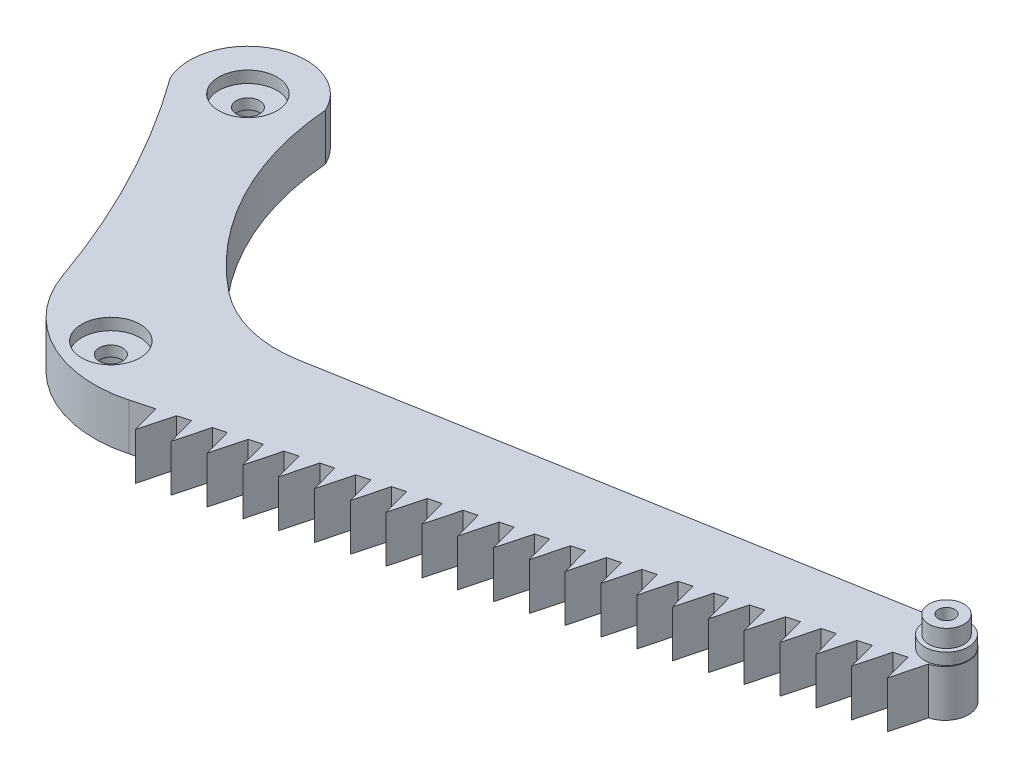
from build123d import *

# Parameters (mm, degrees)
SKETCH1_R                = 1.4
BOSS_EXTRUDE1_DEPTH      = 8
SKETCH2_R                = 3.75
BOSS_EXTRUDE2_DEPTH      = 2
SKETCH3_R                = 3
BOSS_EXTRUDE3_DEPTH      = 3
CUT_EXTRUDE1_DEPTH       = 153.777621068
CUT_EXTRUDE1_DEPTH_BACK  = 153.777621068
SKETCH4_R                = 1.4
FILLET1_R                = 4
SKETCH5_R                = 5.1
CUT_EXTRUDE2_DEPTH       = 3.2
SKETCH6_R                = 4
CUT_EXTRUDE3_DEPTH       = 1
SKETCH7_R                = 5
CUT_EXTRUDE4_DEPTH       = 2
CUT_EXTRUDE5_DEPTH       = 128.709870942
CUT_EXTRUDE5_DEPTH_BACK  = 128.709870942
SKETCH8_R                = 2
SKETCH9_W                = 150
SKETCH9_H                = 50
CUT_EXTRUDE6_DEPTH       = 128.657240829
BOSS_EXTRUDE4_DEPTH      = 8
FILLET2_R                = 10
SKETCH11_R               = 5.25
CUT_EXTRUDE7_DEPTH       = 3.2
SKETCH12_R               = 4
CUT_EXTRUDE8_DEPTH       = 1
SKETCH13_R               = 5
CUT_EXTRUDE9_DEPTH       = 2
CUT_EXTRUDE10_DEPTH      = 128.709870942
CUT_EXTRUDE10_DEPTH_BACK = 128.709870942
SKETCH14_R               = 2
CUT_EXTRUDE11_DEPTH      = 128.657240829
CUT_EXTRUDE11_DEPTH_BACK = 128.657240829
FILLET3_R                = 20
CUT_EXTRUDE12_DEPTH      = 128.657240829
CUT_EXTRUDE12_DEPTH_BACK = 128.657240829
FILLET4_R                = 20
FILLET5_R                = 20
BOSS_EXTRUDE5_DEPTH      = 8
LPATTERN1_COUNT          = 22
LPATTERN1_PITCH          = 5
SKETCH19_R               = 5.25
CUT_EXTRUDE13_DEPTH      = 3.2
SKETCH20_R               = 4
CUT_EXTRUDE14_DEPTH      = 1
CUT_EXTRUDE15_DEPTH      = 129.03726605
CUT_EXTRUDE15_DEPTH_BACK = 129.03726605
SKETCH21_R               = 2
SKETCH22_R               = 5
CUT_EXTRUDE16_DEPTH      = 2


# Some blends are built 0.0001 mm under size
with BuildPart() as part:
    # Sketch1 → Boss-Extrude1 (new body)
    with BuildSketch(Plane(origin=(0, 0, 0), x_dir=(1, 0, 0), z_dir=(0, 1, 0))):
        Polygon((-146.874100845, 0), (146.874100845, 0), (0, -40), align=None)
        with Locations(Location((-117.130755004, -3.915785767, 0), (0, 0, 270))):
            Circle(SKETCH1_R, mode=Mode.SUBTRACT)
        with Locations(Location((0, -30, 0), (0, 0, 270))):
            Circle(SKETCH1_R, mode=Mode.SUBTRACT)
        with Locations(Location((117.130755004, -3.915785767, 0), (0, 0, 270))):
            Circle(SKETCH1_R, mode=Mode.SUBTRACT)
    extrude(amount=BOSS_EXTRUDE1_DEPTH)

    # Sketch2 → Boss-Extrude2 (add)
    with BuildSketch(Plane(origin=(0, 8, 0), x_dir=(1, 0, 0), z_dir=(0, 1, 0))):
        with Locations(Location((117.130755004, -3.915785767, 0), (0, 0, 90))):
            Circle(SKETCH2_R)
    extrude(amount=BOSS_EXTRUDE2_DEPTH)

    # Sketch3 → Boss-Extrude3 (add)
    with BuildSketch(Plane(origin=(0, 10, 0), x_dir=(1, 0, 0), z_dir=(0, 1, 0))):
        with Locations(Location((117.130755004, -3.915785767, 0), (0, 0, 270))):
            Circle(SKETCH3_R)
    extrude(amount=BOSS_EXTRUDE3_DEPTH)

    # Sketch4 → Cut-Extrude1 (cut, two sides: drawn at the far end of the back side and taken through both)
    with BuildSketch(Plane(origin=(0, 13, 0), x_dir=(1, 0, 0), z_dir=(0, 1, 0)).offset(-CUT_EXTRUDE1_DEPTH_BACK)):
        with Locations(Location((117.130755004, -3.915785767, 0), (0, 0, 270))):
            Circle(SKETCH4_R)
    extrude(amount=CUT_EXTRUDE1_DEPTH + CUT_EXTRUDE1_DEPTH_BACK, mode=Mode.SUBTRACT)

    # Fillet1
    fillet1_edges = [part.edges().sort_by_distance(p)[0] for p in [
        (-146.874100845, 4, 0),
        (146.874100845, 4, 0),
    ]]
    fillet(fillet1_edges, radius=FILLET1_R)

    # Sketch5 → Cut-Extrude2 (cut)
    with BuildSketch(Plane.XZ):
        with Locations((-117.130755004, 3.915785767)):
            Circle(SKETCH5_R)
    extrude(amount=-CUT_EXTRUDE2_DEPTH, mode=Mode.SUBTRACT)

    # Sketch6 → Cut-Extrude3 (cut)
    with BuildSketch(Plane.XZ.offset(-3.2)):
        with Locations((-117.130755004, 3.915785767)):
            Circle(SKETCH6_R)
    extrude(amount=-CUT_EXTRUDE3_DEPTH, mode=Mode.SUBTRACT)

    # Sketch7 → Cut-Extrude4 (cut)
    with BuildSketch(Plane(origin=(0, 8, 0), x_dir=(1, 0, 0), z_dir=(0, 1, 0))):
        with Locations((-117.130755004, -3.915785767)):
            Circle(SKETCH7_R)
    extrude(amount=-CUT_EXTRUDE4_DEPTH, mode=Mode.SUBTRACT)

    # Sketch8 → Cut-Extrude5 (cut, two sides: drawn at the far end of the back side and taken through both)
    with BuildSketch(Plane.XZ.offset(-4.2).offset(-CUT_EXTRUDE5_DEPTH_BACK)):
        with Locations(Location((-117.130755004, 3.915785767, 0), (0, 0, 270))):
            Circle(SKETCH8_R)
    extrude(amount=CUT_EXTRUDE5_DEPTH + CUT_EXTRUDE5_DEPTH_BACK, mode=Mode.SUBTRACT)

    # Sketch9 → Cut-Extrude6 (cut, through all)
    with BuildSketch(Plane(origin=(0, 8, 0), x_dir=(1, 0, 0), z_dir=(0, 1, 0))):
        with Locations((-85, -25)):
            Rectangle(SKETCH9_W, SKETCH9_H)
    extrude(amount=-CUT_EXTRUDE6_DEPTH, mode=Mode.SUBTRACT)

    # Sketch10 → Boss-Extrude4 (add)
    with BuildSketch(Plane(origin=(0, 8, 0), x_dir=(1, 0, 0), z_dir=(0, 1, 0))):
        Polygon((-10, -37.276579072), (-38.232590814, 23.268407311), (-20.106435073, 31.720772546), (-5.314795912, 0), (-10, 0), align=None)
    extrude(amount=-BOSS_EXTRUDE4_DEPTH)

    # Fillet2
    fillet2_edges = [part.edges().sort_by_distance(p)[0] for p in [
        (-20.106435073, 4, -31.720772546),
        (-38.232590814, 4, -23.268407311),
    ]]
    fillet(fillet2_edges, radius=FILLET2_R - 0.0001)  # a hair under: the kernel refuses the full size

    # Sketch11 → Cut-Extrude7 (cut)
    with BuildSketch(Plane.XZ):
        with Locations(Location((-24.943330326, -18.431512059, 0), (0, 0, 270))):
            Circle(SKETCH11_R)
    extrude(amount=-CUT_EXTRUDE7_DEPTH, mode=Mode.SUBTRACT)

    # Sketch12 → Cut-Extrude8 (cut)
    with BuildSketch(Plane.XZ.offset(-3.2)):
        with Locations(Location((-24.943330326, -18.431512059, 0), (0, 0, 270))):
            Circle(SKETCH12_R)
    extrude(amount=-CUT_EXTRUDE8_DEPTH, mode=Mode.SUBTRACT)

    # Sketch13 → Cut-Extrude9 (cut)
    with BuildSketch(Plane(origin=(0, 8, 0), x_dir=(1, 0, 0), z_dir=(0, 1, 0))):
        with Locations(Location((-24.943330326, 18.431512059, 0), (0, 0, 270))):
            Circle(SKETCH13_R)
    extrude(amount=-CUT_EXTRUDE9_DEPTH, mode=Mode.SUBTRACT)

    # Sketch14 → Cut-Extrude10 (cut, two sides: drawn at the far end of the back side and taken through both)
    with BuildSketch(Plane.XZ.offset(-4.2).offset(-CUT_EXTRUDE10_DEPTH_BACK)):
        with Locations(Location((-24.943330326, -18.431512059, 0), (0, 0, 270))):
            Circle(SKETCH14_R)
    extrude(amount=CUT_EXTRUDE10_DEPTH + CUT_EXTRUDE10_DEPTH_BACK, mode=Mode.SUBTRACT)

    # Sketch16 → Cut-Extrude11 (cut, two sides: drawn at the far end of the back side and taken through both)
    with BuildSketch(Plane(origin=(0, 8, 0), x_dir=(1, 0, 0), z_dir=(0, 1, 0)).offset(-CUT_EXTRUDE11_DEPTH_BACK)):
        Polygon((-5.314795912, 0), (3.729692447, -19.395967878), (113.729692447, 0), align=None)
    extrude(amount=CUT_EXTRUDE11_DEPTH + CUT_EXTRUDE11_DEPTH_BACK, mode=Mode.SUBTRACT)

    # Fillet3
    fillet3_edges = [part.edges().sort_by_distance(p)[0] for p in [
        (3.729692447, 4, 19.395967878),
    ]]
    fillet(fillet3_edges, radius=FILLET3_R)

    # Sketch17 → Cut-Extrude12 (cut, two sides: drawn at the far end of the back side and taken through both)
    with BuildSketch(Plane(origin=(0, 8, 0), x_dir=(1, 0, 0), z_dir=(0, 1, 0)).offset(-CUT_EXTRUDE12_DEPTH_BACK)):
        with BuildLine():
            Line((-34.006408196, 14.205329441), (-10, -37.276579072))
            ThreePointArc((-10, -37.276579072), (-19.543978786, -10.388869219), (-34.006408196, 14.205329441))
        make_face()
        with BuildLine():
            Line((-15.880252455, 22.657694676), (2.969031552, -12.726090006))
            ThreePointArc((2.969031552, -12.726090006), (-10.157316426, 2.993867794), (-15.880252455, 22.657694676))
        make_face()
    extrude(amount=CUT_EXTRUDE12_DEPTH + CUT_EXTRUDE12_DEPTH_BACK, mode=Mode.SUBTRACT)

    # Fillet4
    # the kernel refuses this fillet: 20 mm, written as the material it takes off along each edge
    with BuildSketch(Plane(origin=(-10, -26.307947418, 37.276579072), x_dir=(-0.2772397367749404, 0, -0.9608007745380734), z_dir=(0, 1, 0))) as fillet4_piece_1:
        with BuildLine():
            CenterArc((11.224724232, -19.987692069), FILLET4_R, 92.010191512, 54.159422267)
            Line((-5.389062305, -8.852967244), (-5.721338035, -8.630272748))
            ThreePointArc((-5.721338035, -8.630272748), (-3.036205438, -4.218496406), (-0.341674286, 0.207987217))
            Line((-0.341674286, 0.207987217), (0.014030905, 0.399753841))
            ThreePointArc((0.014030905, 0.399753841), (5.261589484, 0.307690517), (10.509148062, 0.399753841))
            Line((10.509148062, 0.399753841), (10.523178967, 0))
        make_face()
    extrude(amount=60.615894837, mode=Mode.SUBTRACT)

    # Fillet5
    # the kernel refuses this fillet: 20 mm, written as the material it takes off along each edge
    with BuildSketch(Plane(origin=(0, -51.987814503, 40), x_dir=(-0.6649550163020994, 0, -0.746883408769183), z_dir=(0, 1, 0))) as fillet5_piece_1:
        with BuildLine():
            CenterArc((13.146071877, -18.479501456), FILLET5_R, 67.51430871, 86.041392207)
            Line((-4.761282448, -9.572949875), (-6.552017881, -8.682294717))
            Line((-6.552017881, -8.682294717), (-1.790735433, 0.890655158))
            Line((-1.790735433, 0.890655158), (-1.017670329, 1.721727941))
            ThreePointArc((-1.017670329, 1.721727941), (18.974933836, 2.946825813), (21.560031193, 1.847950146))
            Line((21.560031193, 1.847950146), (20.795125801, 0))
        make_face()
    extrude(amount=111.975629005, mode=Mode.SUBTRACT)

    # Sketch18 → Boss-Extrude5 (add)
    with BuildSketch(Plane(origin=(0, 8, 0), x_dir=(1, 0, 0), z_dir=(0, 1, 0))):
        Polygon((118.015424178, -7.859432398), (116.543976131, -13.442278803), (115.230118761, -8.617988305), align=None)
    boss_extrude5 = extrude(amount=-BOSS_EXTRUDE5_DEPTH)

    # LPattern1: Boss-Extrude5 ×22
    with Locations(*[Vector(-0.9648580996210196, 0, 0.26277147409053875) * (i * LPATTERN1_PITCH) for i in range(1, LPATTERN1_COUNT)]):
        add(boss_extrude5)

    # Sketch19 → Cut-Extrude13 (cut)
    with BuildSketch(Plane.XZ):
        with Locations(Location((0, 30, 0), (0, 0, 270))):
            Circle(SKETCH19_R)
    extrude(amount=-CUT_EXTRUDE13_DEPTH, mode=Mode.SUBTRACT)

    # Sketch20 → Cut-Extrude14 (cut)
    with BuildSketch(Plane.XZ.offset(-3.2)):
        with Locations(Location((0, 30, 0), (0, 0, 270))):
            Circle(SKETCH20_R)
    extrude(amount=-CUT_EXTRUDE14_DEPTH, mode=Mode.SUBTRACT)

    # Sketch21 → Cut-Extrude15 (cut, two sides: drawn at the far end of the back side and taken through both)
    with BuildSketch(Plane.XZ.offset(-4.2).offset(-CUT_EXTRUDE15_DEPTH_BACK)):
        with Locations(Location((0, 30, 0), (0, 0, 270))):
            Circle(SKETCH21_R)
    extrude(amount=CUT_EXTRUDE15_DEPTH + CUT_EXTRUDE15_DEPTH_BACK, mode=Mode.SUBTRACT)

    # Sketch22 → Cut-Extrude16 (cut)
    with BuildSketch(Plane(origin=(0, 8, 0), x_dir=(1, 0, 0), z_dir=(0, 1, 0))):
        with Locations(Location((0, -30, 0), (0, 0, 270))):
            Circle(SKETCH22_R)
    extrude(amount=-CUT_EXTRUDE16_DEPTH, mode=Mode.SUBTRACT)


solid = part.part
